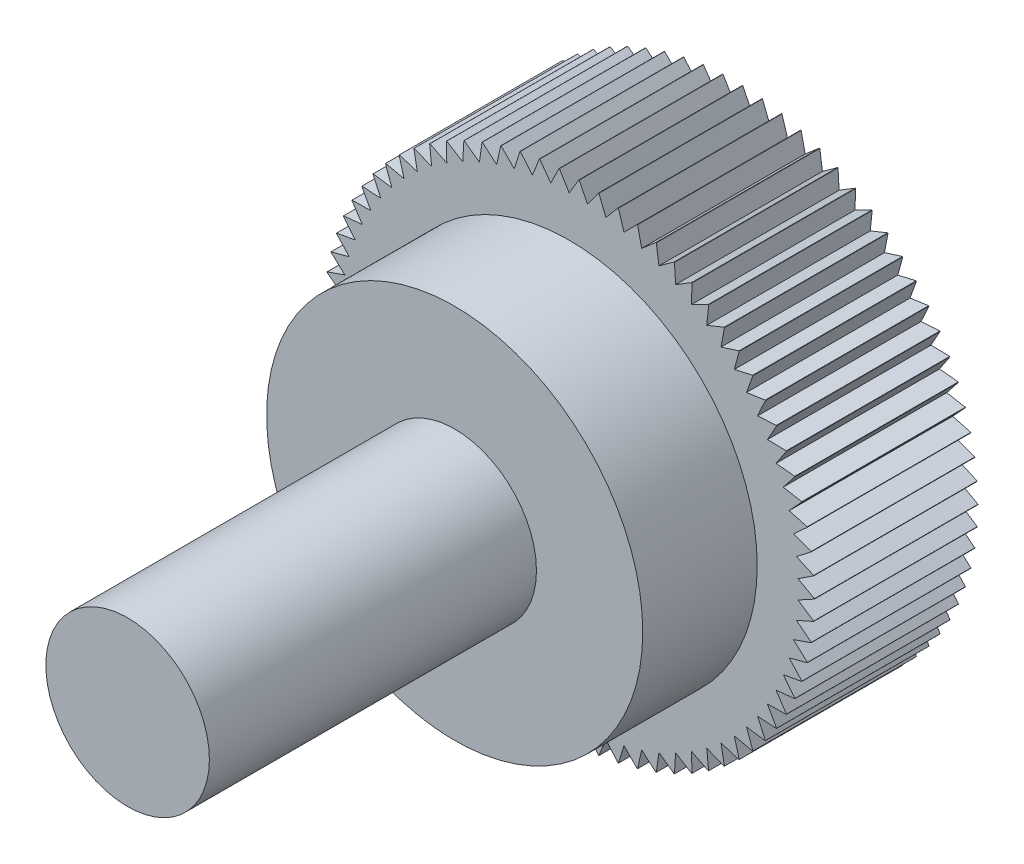
from build123d import *

# Parameters (mm, degrees)
SKETCH1_R          = 7.5
EXTRUDE1_DEPTH     = 5
SKETCH2_R          = 5.75
EXTRUDE2_DEPTH     = 3.5
SKETCH3_R          = 2.5
EXTRUDE3_DEPTH     = 10
CUT_EXTRUDE1_DEPTH = 20
SKETCH5_R          = 4
CUT_EXTRUDE2_DEPTH = 0.5


with BuildPart() as part:
    # Sketch1 → Extrude1 (new body)
    with BuildSketch(Plane.XY):
        Circle(SKETCH1_R)
    extrude(amount=EXTRUDE1_DEPTH)

    # Sketch2 → Extrude2 (add)
    with BuildSketch(Plane.XY.offset(5)):
        Circle(SKETCH2_R)
    extrude(amount=EXTRUDE2_DEPTH)

    # Sketch3 → Extrude3 (add)
    with BuildSketch(Plane.XY.offset(8.5)):
        Circle(SKETCH3_R)
    extrude(amount=EXTRUDE3_DEPTH)

    # Sketch4 → Cut-Extrude1 (cut)
    with BuildSketch(Plane(origin=(0, 0, 0), x_dir=(-1, 0, 0), z_dir=(0, 0, -1))):
        Polygon((-0.3, 7.5), (0, 7), (0.3, 7.5), align=None)
        Polygon((0.304472073, 7.499819782), (0.563265981, 6.977301157), (0.902526458, 7.45153984), align=None)
        Polygon((0.906969528, 7.451000354), (1.122878966, 6.909351838), (1.499199685, 7.354753586), align=None)
        Polygon((1.503584937, 7.35385833), (1.67520965, 6.796592722), (2.086150027, 7.210268931), align=None)
        Polygon((2.090449021, 7.209023713), (2.216675957, 6.639755094), (2.659570886, 7.019022916), align=None)
        Polygon((2.663755741, 7.01743581), (2.743766269, 6.439856106), (3.215743407, 6.782255844), align=None)
        Polygon((3.219786983, 6.780337144), (3.253062204, 6.19819218), (3.751060598, 6.501503241), align=None)
        Polygon((3.75493667, 6.499265389), (3.741260783, 5.916330599), (4.262050722, 6.178585894), align=None)
        Polygon((4.265734153, 6.176043405), (4.20519585, 5.596099344), (4.745399811, 5.815598046), align=None)
        Polygon((4.748866712, 5.812767409), (4.641858608, 5.239575237), (5.197973161, 5.414893814), align=None)
        Polygon((5.201201049, 5.411793386), (5.048417131, 4.849070475), (5.616835661, 4.979071917), align=None)
        Polygon((5.619803601, 4.975721806), (5.422234733, 4.427117629), (5.999270826, 4.510958828), align=None)
        Polygon((6.00195957, 4.50738076), (5.760887061, 3.976453227), (6.342798418, 4.013590441), align=None)
        Polygon((6.345190528, 4.009807621), (6.062177826, 3.5), (6.645190528, 3.490192379), align=None)
        Polygon((6.647270491, 3.486229341), (6.324153042, 3.00084793), (6.904486028, 2.94415908), align=None)
        Polygon((6.906240354, 2.940041526), (6.545113699, 2.482234209), (7.119003286, 2.37903178), align=None)
        Polygon((7.120420598, 2.374786413), (6.723626781, 1.947522247), (7.287351076, 1.798475546), align=None)
        Polygon((7.288422182, 1.794129899), (6.858534564, 1.400179856), (7.408437598, 1.206255508), align=None)
        Polygon((7.409155552, 1.201837764), (6.948962119, 0.843756762), (7.48147756, 0.60621244), align=None)
        Polygon((7.481837704, 0.60175125), (6.994322987, 0.281861581), (7.505997268, 0.002237851), align=None)
        Polygon((7.505997268, -0.002237851), (6.994322987, -0.281861581), (7.481837704, -0.60175125), align=None)
        Polygon((7.48147756, -0.60621244), (6.948962119, -0.843756762), (7.409155552, -1.201837764), align=None)
        Polygon((7.408437598, -1.206255508), (6.858534564, -1.400179856), (7.288422182, -1.794129899), align=None)
        Polygon((7.287351076, -1.798475546), (6.723626781, -1.947522247), (7.120420598, -2.374786413), align=None)
        Polygon((7.119003286, -2.37903178), (6.545113699, -2.482234209), (6.906240354, -2.940041526), align=None)
        Polygon((6.904486028, -2.94415908), (6.324153042, -3.00084793), (6.647270491, -3.486229341), align=None)
        Polygon((6.645190528, -3.490192379), (6.062177826, -3.5), (6.345190528, -4.009807621), align=None)
        Polygon((6.342798418, -4.013590441), (5.760887061, -3.976453227), (6.00195957, -4.50738076), align=None)
        Polygon((5.999270826, -4.510958828), (5.422234733, -4.427117629), (5.619803601, -4.975721806), align=None)
        Polygon((5.616835661, -4.979071917), (5.048417131, -4.849070475), (5.201201049, -5.411793386), align=None)
        Polygon((5.197973161, -5.414893814), (4.641858608, -5.239575237), (4.748866712, -5.812767409), align=None)
        Polygon((4.745399811, -5.815598046), (4.20519585, -5.596099344), (4.265734153, -6.176043405), align=None)
        Polygon((4.262050722, -6.178585894), (3.741260783, -5.916330599), (3.75493667, -6.499265389), align=None)
        Polygon((3.751060598, -6.501503241), (3.253062204, -6.19819218), (3.219786983, -6.780337144), align=None)
        Polygon((3.215743407, -6.782255844), (2.743766269, -6.439856106), (2.663755741, -7.01743581), align=None)
        Polygon((2.659570886, -7.019022916), (2.216675957, -6.639755094), (2.090449021, -7.209023713), align=None)
        Polygon((2.086150027, -7.210268931), (1.67520965, -6.796592722), (1.503584937, -7.35385833), align=None)
        Polygon((1.499199685, -7.354753586), (1.122878966, -6.909351838), (0.906969528, -7.451000354), align=None)
        Polygon((0.902526458, -7.45153984), (0.563265981, -6.977301157), (0.304472073, -7.499819782), align=None)
        Polygon((0.3, -7.5), (0, -7), (-0.3, -7.5), align=None)
        Polygon((-0.304472073, -7.499819782), (-0.563265981, -6.977301157), (-0.902526458, -7.45153984), align=None)
        Polygon((-0.906969528, -7.451000354), (-1.122878966, -6.909351838), (-1.499199685, -7.354753586), align=None)
        Polygon((-1.503584937, -7.35385833), (-1.67520965, -6.796592722), (-2.086150027, -7.210268931), align=None)
        Polygon((-2.090449021, -7.209023713), (-2.216675957, -6.639755094), (-2.659570886, -7.019022916), align=None)
        Polygon((-2.663755741, -7.01743581), (-2.743766269, -6.439856106), (-3.215743407, -6.782255844), align=None)
        Polygon((-3.219786983, -6.780337144), (-3.253062204, -6.19819218), (-3.751060598, -6.501503241), align=None)
        Polygon((-3.75493667, -6.499265389), (-3.741260783, -5.916330599), (-4.262050722, -6.178585894), align=None)
        Polygon((-4.265734153, -6.176043405), (-4.20519585, -5.596099344), (-4.745399811, -5.815598046), align=None)
        Polygon((-4.748866712, -5.812767409), (-4.641858608, -5.239575237), (-5.197973161, -5.414893814), align=None)
        Polygon((-5.201201049, -5.411793386), (-5.048417131, -4.849070475), (-5.616835661, -4.979071917), align=None)
        Polygon((-5.619803601, -4.975721806), (-5.422234733, -4.427117629), (-5.999270826, -4.510958828), align=None)
        Polygon((-6.00195957, -4.50738076), (-5.760887061, -3.976453227), (-6.342798418, -4.013590441), align=None)
        Polygon((-6.345190528, -4.009807621), (-6.062177826, -3.5), (-6.645190528, -3.490192379), align=None)
        Polygon((-6.647270491, -3.486229341), (-6.324153042, -3.00084793), (-6.904486028, -2.94415908), align=None)
        Polygon((-6.906240354, -2.940041526), (-6.545113699, -2.482234209), (-7.119003286, -2.37903178), align=None)
        Polygon((-7.120420598, -2.374786413), (-6.723626781, -1.947522247), (-7.287351076, -1.798475546), align=None)
        Polygon((-7.288422182, -1.794129899), (-6.858534564, -1.400179856), (-7.408437598, -1.206255508), align=None)
        Polygon((-7.409155552, -1.201837764), (-6.948962119, -0.843756762), (-7.48147756, -0.60621244), align=None)
        Polygon((-7.481837704, -0.60175125), (-6.994322987, -0.281861581), (-7.505997268, -0.002237851), align=None)
        Polygon((-7.505997268, 0.002237851), (-6.994322987, 0.281861581), (-7.481837704, 0.60175125), align=None)
        Polygon((-7.48147756, 0.60621244), (-6.948962119, 0.843756762), (-7.409155552, 1.201837764), align=None)
        Polygon((-7.408437598, 1.206255508), (-6.858534564, 1.400179856), (-7.288422182, 1.794129899), align=None)
        Polygon((-7.287351076, 1.798475546), (-6.723626781, 1.947522247), (-7.120420598, 2.374786413), align=None)
        Polygon((-7.119003286, 2.37903178), (-6.545113699, 2.482234209), (-6.906240354, 2.940041526), align=None)
        Polygon((-6.904486028, 2.94415908), (-6.324153042, 3.00084793), (-6.647270491, 3.486229341), align=None)
        Polygon((-6.645190528, 3.490192379), (-6.062177826, 3.5), (-6.345190528, 4.009807621), align=None)
        Polygon((-6.342798418, 4.013590441), (-5.760887061, 3.976453227), (-6.00195957, 4.50738076), align=None)
        Polygon((-5.999270826, 4.510958828), (-5.422234733, 4.427117629), (-5.619803601, 4.975721806), align=None)
        Polygon((-5.616835661, 4.979071917), (-5.048417131, 4.849070475), (-5.201201049, 5.411793386), align=None)
        Polygon((-5.197973161, 5.414893814), (-4.641858608, 5.239575237), (-4.748866712, 5.812767409), align=None)
        Polygon((-4.745399811, 5.815598046), (-4.20519585, 5.596099344), (-4.265734153, 6.176043405), align=None)
        Polygon((-4.262050722, 6.178585894), (-3.741260783, 5.916330599), (-3.75493667, 6.499265389), align=None)
        Polygon((-3.751060598, 6.501503241), (-3.253062204, 6.19819218), (-3.219786983, 6.780337144), align=None)
        Polygon((-3.215743407, 6.782255844), (-2.743766269, 6.439856106), (-2.663755741, 7.01743581), align=None)
        Polygon((-2.659570886, 7.019022916), (-2.216675957, 6.639755094), (-2.090449021, 7.209023713), align=None)
        Polygon((-2.086150027, 7.210268931), (-1.67520965, 6.796592722), (-1.503584937, 7.35385833), align=None)
        Polygon((-1.499199685, 7.354753586), (-1.122878966, 6.909351838), (-0.906969528, 7.451000354), align=None)
        Polygon((-0.902526458, 7.45153984), (-0.563265981, 6.977301157), (-0.304472073, 7.499819782), align=None)
    extrude(amount=-CUT_EXTRUDE1_DEPTH, mode=Mode.SUBTRACT)

    # Sketch5 → Cut-Extrude2 (cut)
    with BuildSketch(Plane(origin=(0, 0, 0), x_dir=(-1, 0, 0), z_dir=(0, 0, -1))):
        Circle(SKETCH5_R)
    extrude(amount=-CUT_EXTRUDE2_DEPTH, mode=Mode.SUBTRACT)


solid = part.part
